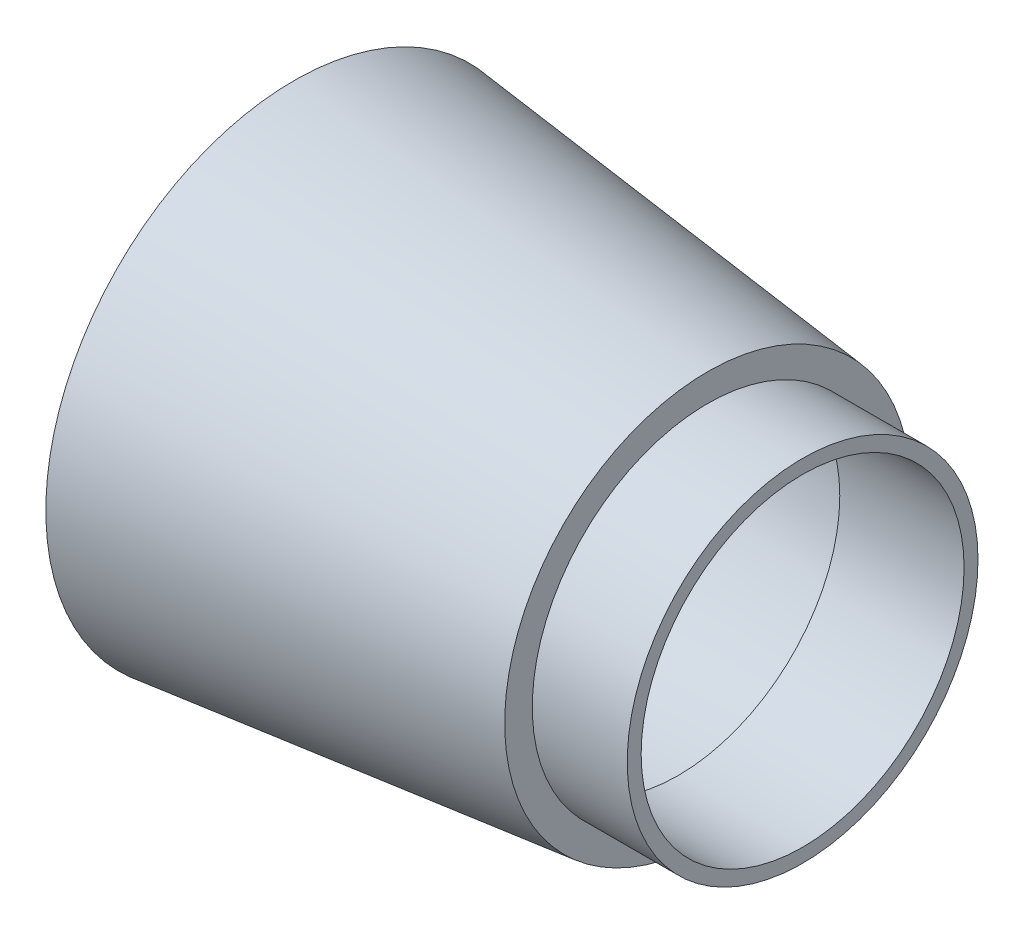
from build123d import *

# Parameters (mm, degrees)
SKETCH2_W      = 0.625748312
SKETCH2_H      = 0.221900722
REVOLVE5_ANGLE = 180


with BuildPart() as part:
    # Sketch1 → Revolve4 (revolve)
    with BuildSketch(Plane.XY):
        Polygon((-12.065, 11.43), (-12.065, 10.16), (-7.391974639, 9.649082561), (-7.391974639, 0), (-2.54, 0), (-2.54, 9.1186), (5.633488572, 8.22496525), (5.633488572, 7.43621361), (11.358064917, 7.43621361), (11.358064917, 8.0772), (6.985, 8.0772), (6.985, 9.3472), align=None)
    revolve(axis=Axis((44.726440805, 0, 0), (-1, 0, 0)))

    # Sketch2 → Revolve5 (revolve)
    with BuildSketch(Plane(origin=(-2.54, 0, 0), x_dir=(0, 0, -1), z_dir=(1, 0, 0))):
        with Locations((0, 0.897225516)):
            Rectangle(SKETCH2_W, SKETCH2_H)
    revolve(axis=Axis((-2.54, 0, 0.312874156), (0, 0, -1)), revolution_arc=REVOLVE5_ANGLE)


solid = part.part
